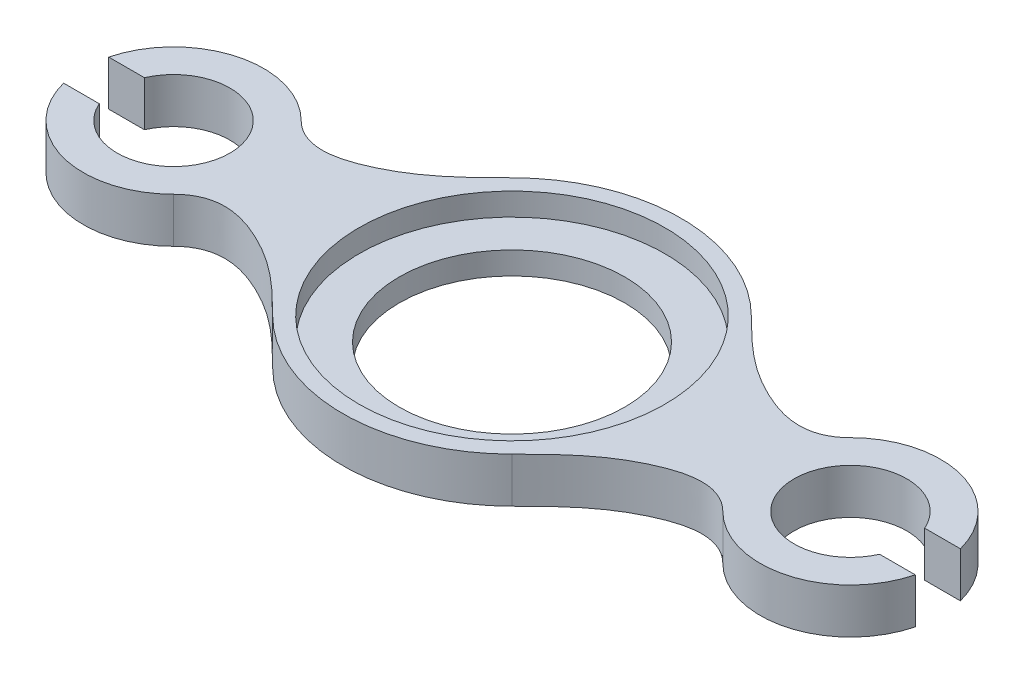
from build123d import *

# Parameters (mm, degrees)
SKETCH1_R                = 67.8
SKETCH1_R_2              = 50
BOSS_EXTRUDE1_DEPTH      = 10
BOSS_EXTRUDE4_DEPTH      = 10
BOSS_EXTRUDE4_DEPTH_BACK = 10
SKETCH2_R                = 25
SKETCH2_R_2              = 67.8
CUT_EXTRUDE1_START       = -20
CUT_EXTRUDE1_DEPTH       = 20


# Read off the part's stored shape, not the designer's step: Cut-Extrude1
with BuildPart() as part:
    # Sketch1 → Boss-Extrude1 (new body)
    with BuildSketch(Plane(origin=(0, 0, 0), x_dir=(1, 0, 0), z_dir=(0, 1, 0))):
        with Locations(Location((0, 0, 0), (0, 0, 270))):
            Circle(SKETCH1_R)
        with Locations(Location((0, 0, 0), (0, 0, 270))):
            Circle(SKETCH1_R_2, mode=Mode.SUBTRACT)
    extrude(amount=BOSS_EXTRUDE1_DEPTH)

    # Sketch2 → Boss-Extrude4 (add, two sides: drawn at the far end of the back side and taken through both)
    with BuildSketch(Plane(origin=(0, 10, 0), x_dir=(1, 0, 0), z_dir=(0, 1, 0)).offset(-BOSS_EXTRUDE4_DEPTH_BACK)):
        with BuildLine():
            ThreePointArc((150, -40), (190, 0), (150, 40))
            ThreePointArc((150, 40), (134.692662705, 36.9551813), (121.715728753, 28.284271247))
            add(Edge.make_bspline(
                [(53.033008589, 53.033008589), (65.214190565, 40.851826613), (81.157405982, 26.386889755), (111.148754798, 17.717297293), (121.715728753, 28.284271247)],
                knots=[0, 0, 0, 0, 0.557862637, 1, 1, 1, 1], degree=3))
            ThreePointArc((53.033008589, 53.033008589), (0, 75), (-53.033008589, 53.033008589))
            add(Edge.make_bspline(
                [(-53.033008589, 53.033008589), (-65.214190565, 40.851826613), (-81.157405982, 26.386889755), (-111.148754798, 17.717297293), (-121.715728753, 28.284271247)],
                knots=[0, 0, 0, 0, 0.557862637, 1, 1, 1, 1], degree=3))
            ThreePointArc((-121.715728753, 28.284271247), (-134.692662705, 36.9551813), (-150, 40))
            ThreePointArc((-150, 40), (-190, 0), (-150, -40))
            ThreePointArc((-150, -40), (-134.692662705, -36.9551813), (-121.715728753, -28.284271247))
            add(Edge.make_bspline(
                [(-53.033008589, -53.033008589), (-65.214190565, -40.851826613), (-81.157405982, -26.386889755), (-111.148754798, -17.717297293), (-121.715728753, -28.284271247)],
                knots=[0, 0, 0, 0, 0.557862637, 1, 1, 1, 1], degree=3))
            ThreePointArc((-53.033008589, -53.033008589), (0, -75), (53.033008589, -53.033008589))
            add(Edge.make_bspline(
                [(53.033008589, -53.033008589), (65.214190565, -40.851826613), (81.157405982, -26.386889755), (111.148754798, -17.717297293), (121.715728753, -28.284271247)],
                knots=[0, 0, 0, 0, 0.557862637, 1, 1, 1, 1], degree=3))
            ThreePointArc((121.715728753, -28.284271247), (134.692662705, -36.9551813), (150, -40))
        make_face()
        with Locations(Location((-150, 0, 0), (0, 0, 270))):
            Circle(SKETCH2_R, mode=Mode.SUBTRACT)
        with Locations(Location((0, 0, 0), (0, 0, 270))):
            Circle(SKETCH2_R_2, mode=Mode.SUBTRACT)
        with Locations(Location((150, 0, 0), (0, 0, 270))):
            Circle(SKETCH2_R, mode=Mode.SUBTRACT)
    extrude(amount=BOSS_EXTRUDE4_DEPTH + BOSS_EXTRUDE4_DEPTH_BACK)

    # Cut-Extrude1 outline → Cut-Extrude1 (cut)
    with BuildSketch(Plane(origin=(0, 20, 0), x_dir=(1, 0, 0), z_dir=(0, 1, 0)).offset(CUT_EXTRUDE1_START)):
        with BuildLine():
            ThreePointArc((188.729833462, -10), (190, 0), (188.729833462, 10))
            Line((188.729833462, 10), (172.912878475, 10))
            ThreePointArc((172.912878475, 10), (175, 0), (172.912878475, -10))
            Line((172.912878475, -10), (188.729833462, -10))
        make_face()
        with BuildLine():
            ThreePointArc((-172.912878475, -10), (-175, 0), (-172.912878475, 10))
            Line((-172.912878475, 10), (-188.729833462, 10))
            ThreePointArc((-188.729833462, 10), (-190, 0), (-188.729833462, -10))
            Line((-188.729833462, -10), (-172.912878475, -10))
        make_face()
    extrude(amount=CUT_EXTRUDE1_DEPTH, mode=Mode.SUBTRACT)


solid = part.part
